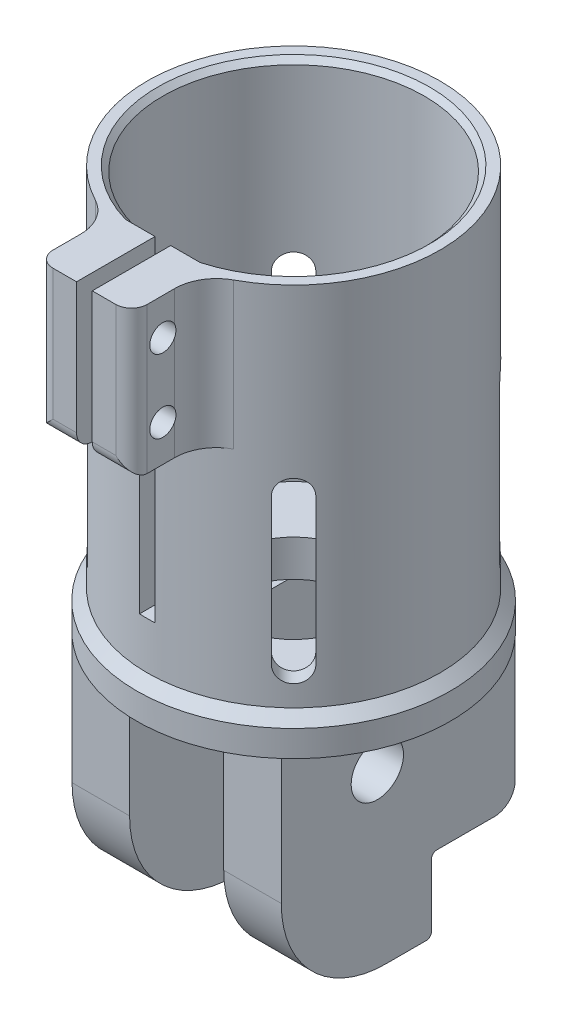
from build123d import *
from build123d.topology import SkipClean

# Parameters (mm, degrees)
CHANFREIN1_SIZE              = 1
ESQUISSE2_W                  = 5.5
ESQUISSE2_H                  = 22.360679774
BOSS_EXTRU_1_DEPTH           = 22
CONG_1_R                     = 10
ESQUISSE3_W                  = 8
ESQUISSE3_H                  = 7
ENL_V_MAT_EXTRU_1_DEPTH      = 49.293374287
CONG_2_R                     = 2
CONG_3_R                     = 0.5
ENL_V_MAT_EXTRU_2_DEPTH      = 44.957365708
ENL_V_MAT_EXTRU_2_DEPTH_BACK = 44.957365708
ESQUISSE4_R                  = 2.5
CHANFREIN2_SIZE              = 0.5
ESQUISSE6_W                  = 7.5
ESQUISSE6_H                  = 14
BOSS_EXTRU_2_DEPTH           = 4.5
CONG_4_R                     = 4
CONG_5_R                     = 1.5
ESQUISSE5_W                  = 1.5
ESQUISSE5_H                  = 61
ENL_V_MAT_EXTRU_3_DEPTH      = 46.904792778
ENL_V_MAT_EXTRU_4_DEPTH      = 46.904792778
ENL_V_MAT_EXTRU_4_DEPTH_BACK = 46.904792778
ESQUISSE7_R                  = 1.25
ENL_V_MAT_EXTRU_5_REACH      = 56.738
ENL_V_MAT_EXTRU_5_END_RADIUS = 12.5
R_P_TITION_CIRCULAIRE1_COUNT = 4


with BuildPart() as part:
    # Esquisse1 → Révolution1 (revolve)
    with BuildSketch(Plane.XY, mode=Mode.PRIVATE) as r_volution1_sk:
        Polygon((-6, 0), (-15, 0), (-15, 3.5), (-14, 3.5), (-14, 38.5), (-12.5, 38.5), (-12.5, 3.5), (-6, 3.5), align=None)
    revolve(r_volution1_sk.sketch.rotate(Axis((0, 0, 0), (0, 1, 0)), 270), axis=Axis((0, 0, 0), (0, 1, 0)))

    # Chanfrein1
    chanfrein1_edges = [part.edges().sort_by_distance(p)[0] for p in [
        (0, 3.5, 15),
    ]]
    chamfer(chanfrein1_edges, length=CHANFREIN1_SIZE - 0.0001)  # a hair under: the kernel refuses the full size

    # Esquisse2 → Boss.-Extru.1 (add)
    with BuildSketch(Plane.XZ):
        with Locations((-7.25, 0)):
            Rectangle(ESQUISSE2_W, ESQUISSE2_H)
        with Locations((7.25, 0)):
            Rectangle(ESQUISSE2_W, ESQUISSE2_H)
    extrude(amount=BOSS_EXTRU_1_DEPTH)

    # Congé1
    cong_1_edges = [part.edges().sort_by_distance(p)[0] for p in [
        (-7.25, -22, 11.180339887),
        (7.25, -22, 11.180339887),
    ]]
    fillet(cong_1_edges, radius=CONG_1_R)

    # Esquisse3 → Enlèv. mat.-Extru.1 (cut, through all)
    with BuildSketch(Plane.ZY.offset(10)):
        with Locations((-7.180339887, -18.5)):
            Rectangle(ESQUISSE3_W, ESQUISSE3_H)
    extrude(amount=-ENL_V_MAT_EXTRU_1_DEPTH, mode=Mode.SUBTRACT)

    # Congé2
    cong_2_edges = [part.edges().sort_by_distance(p)[0] for p in [
        (-7.25, -15, -11.180339887),
        (7.25, -15, -11.180339887),
    ]]
    fillet(cong_2_edges, radius=CONG_2_R)

    # Congé3
    cong_3_edges = [part.edges().sort_by_distance(p)[0] for p in [
        (7.25, -22, -3.180339887),
        (-7.25, -22, -3.180339887),
        (-7.25, -15, -3.180339887),
        (7.25, -15, -3.180339887),
    ]]
    fillet(cong_3_edges, radius=CONG_3_R)

    # Esquisse4 → Enlèv. mat.-Extru.2 (cut, two sides: drawn at the far end of the back side and taken through both)
    with BuildSketch(Plane(origin=(0, 0, 0), x_dir=(0, 0, -1), z_dir=(1, 0, 0)).offset(-ENL_V_MAT_EXTRU_2_DEPTH_BACK)):
        with Locations((-2, -5.5)):
            Circle(ESQUISSE4_R)
    extrude(amount=ENL_V_MAT_EXTRU_2_DEPTH + ENL_V_MAT_EXTRU_2_DEPTH_BACK, mode=Mode.SUBTRACT)

    # Chanfrein2
    chanfrein2_edges = [part.edges().sort_by_distance(p)[0] for p in [
        (0, 38.5, 12.5),
    ]]
    chamfer(chanfrein2_edges, length=CHANFREIN2_SIZE)

    # Esquisse6 → Boss.-Extru.2 (add, symmetric)
    with SkipClean():  # the faces are left unmerged after this step: merging them gives an invalid solid
        with BuildSketch(Plane(origin=(0, 0, 0), x_dir=(0, 0, -1), z_dir=(1, 0, 0))):
            with Locations((-16.25, 31.5)):
                Rectangle(ESQUISSE6_W, ESQUISSE6_H)
        extrude(amount=BOSS_EXTRU_2_DEPTH, both=True)

    # Congé4
    cong_4_edges = [part.edges().sort_by_distance(p)[0] for p in [
        (-4.5, 31.5, 13.257073584),
        (4.5, 31.5, 13.257073584),
    ]]
    fillet(cong_4_edges, radius=CONG_4_R)

    # Congé5
    cong_5_edges = [part.edges().sort_by_distance(p)[0] for p in [
        (4.5, 31.5, 20),
        (0, 24.5, 20),
        (-4.5, 31.5, 20),
    ]]
    fillet(cong_5_edges, radius=CONG_5_R)

    # Esquisse5 → Enlèv. mat.-Extru.3 (cut, through all)
    with BuildSketch(Plane.XY):
        with Locations((0, 38.5)):
            Rectangle(ESQUISSE5_W, ESQUISSE5_H)
    extrude(amount=ENL_V_MAT_EXTRU_3_DEPTH, mode=Mode.SUBTRACT)

    # Esquisse7 → Enlèv. mat.-Extru.4 (cut, two sides: drawn at the far end of the back side and taken through both)
    with BuildSketch(Plane(origin=(0, 0, 0), x_dir=(0, 0, -1), z_dir=(1, 0, 0)).offset(-ENL_V_MAT_EXTRU_4_DEPTH_BACK)):
        with Locations((-17, 28)):
            Circle(ESQUISSE7_R)
        with Locations((-17, 35)):
            Circle(ESQUISSE7_R)
    extrude(amount=ENL_V_MAT_EXTRU_4_DEPTH + ENL_V_MAT_EXTRU_4_DEPTH_BACK, mode=Mode.SUBTRACT)

    # Enlèv. mat.-Extru.5: up to this cylinder (the profile starts outside it)
    enl_v_mat_extru_5_end = Plane(origin=(0, 14, 0), z_dir=(0, -1, 0)) * Cylinder(ENL_V_MAT_EXTRU_5_END_RADIUS, 139.476, mode=Mode.PRIVATE)
    # Esquisse8 → Enlèv. mat.-Extru.5 (cut, up to the surface)
    with BuildSketch(Plane(origin=(9.899494937, 0, -9.899494937), x_dir=(0, -1, 0), z_dir=(0.7071067811865488, 0, -0.7071067811865464)), mode=Mode.PRIVATE) as enl_v_mat_extru_5_sk1:
        with BuildLine():
            Line((-7, -1.5), (-21, -1.5))
            ThreePointArc((-21, -1.5), (-22.5, 0), (-21, 1.5))
            Line((-21, 1.5), (-7, 1.5))
            ThreePointArc((-7, 1.5), (-5.5, 0), (-7, -1.5))
        make_face()
    enl_v_mat_extru_5_tool1 = extrude(enl_v_mat_extru_5_sk1.sketch, amount=-ENL_V_MAT_EXTRU_5_REACH, mode=Mode.PRIVATE) - enl_v_mat_extru_5_end
    enl_v_mat_extru_5 = enl_v_mat_extru_5_tool1.solids().sort_by_distance((9.899495, 14, -9.899495))[0]
    add(enl_v_mat_extru_5, mode=Mode.SUBTRACT)

    # Répétition circulaire1: Enlèv. mat.-Extru.5 ×4 about axis
    r_p_tition_circulaire1_axis = Axis((0, 0, 0), (0, 1, 0))
    for i in range(1, R_P_TITION_CIRCULAIRE1_COUNT):
        add(enl_v_mat_extru_5.rotate(r_p_tition_circulaire1_axis, i * 360 / R_P_TITION_CIRCULAIRE1_COUNT), mode=Mode.SUBTRACT)


solid = part.part
